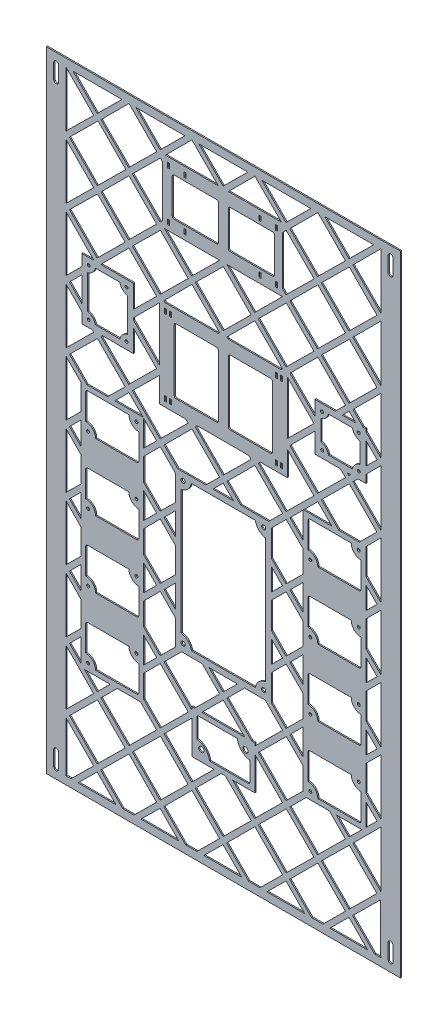
from build123d import *

# Parameters (mm, degrees)
SKETCH1_W           = 457.2
SKETCH1_H           = 812.8
BOARD_DEPTH         = 1.5875
SKETCH3_W           = 2.54
SKETCH3_H           = 6.35
ROBORIO_CHECK_DEPTH = 467.284720054
SKETCH4_W           = 2.54
SKETCH4_H           = 6.35
DLINK_CHECK_DEPTH   = 467.284720054
SKETCH5_R           = 1.905
VRM_DEPTH           = 467.284720054
SKETCH6_R           = 1.8415
SKETCH6_R_2         = 1.9304
PCM_DEPTH           = 467.284720054
SKETCH7_R           = 2.667
PDP_DEPTH           = 467.284720054
SKETCH8_R           = 3.429
MAIN_BREAKER_DEPTH  = 467.284720054
SKETCH9_R           = 1.905
CUT_EXTRUDE3_DEPTH  = 467.284720054
FILLET1_R           = 2.54
CUT_EXTRUDE4_DEPTH  = 467.284720054
CUT_EXTRUDE6_START  = -1.5875
CUT_EXTRUDE6_DEPTH  = 1.5875


# Read off the part's stored shape, not the designer's step: Cut-Extrude6
with BuildPart() as part:
    # Sketch1 → Board (new body)
    with BuildSketch(Plane.XY):
        Rectangle(SKETCH1_W, SKETCH1_H)
        with BuildLine():
            Line((-212.725, 393.7), (-212.725, 374.65))
            ThreePointArc((-212.725, 374.65), (-215.9, 371.475), (-219.075, 374.65))
            Line((-219.075, 374.65), (-219.075, 393.7))
            ThreePointArc((-219.075, 393.7), (-215.9, 396.875), (-212.725, 393.7))
        make_face(mode=Mode.SUBTRACT)
        with BuildLine():
            Line((-212.725, -374.65), (-212.725, -393.7))
            ThreePointArc((-212.725, -393.7), (-215.9, -396.875), (-219.075, -393.7))
            Line((-219.075, -393.7), (-219.075, -374.65))
            ThreePointArc((-219.075, -374.65), (-215.9, -371.475), (-212.725, -374.65))
        make_face(mode=Mode.SUBTRACT)
        with BuildLine():
            Line((219.075, 393.7), (219.075, 374.65))
            ThreePointArc((219.075, 374.65), (215.9, 371.475), (212.725, 374.65))
            Line((212.725, 374.65), (212.725, 393.7))
            ThreePointArc((212.725, 393.7), (215.9, 396.875), (219.075, 393.7))
        make_face(mode=Mode.SUBTRACT)
        with BuildLine():
            Line((219.075, -374.65), (219.075, -393.7))
            ThreePointArc((219.075, -393.7), (215.9, -396.875), (212.725, -393.7))
            Line((212.725, -393.7), (212.725, -374.65))
            ThreePointArc((212.725, -374.65), (215.9, -371.475), (219.075, -374.65))
        make_face(mode=Mode.SUBTRACT)
    extrude(amount=BOARD_DEPTH)

    # Sketch3 → RoboRio (check) (cut, through all)
    with BuildSketch(Plane.XY.offset(1.5875)):
        with Locations((-68.58, 187.325)):
            Rectangle(SKETCH3_W, SKETCH3_H)
        with Locations((-74.93, 187.325)):
            Rectangle(SKETCH3_W, SKETCH3_H)
        with Locations((74.93, 187.325)):
            Rectangle(SKETCH3_W, SKETCH3_H)
        with Locations((68.58, 187.325)):
            Rectangle(SKETCH3_W, SKETCH3_H)
        with Locations((-68.58, 89.535)):
            Rectangle(SKETCH3_W, SKETCH3_H)
        with Locations((-74.93, 89.535)):
            Rectangle(SKETCH3_W, SKETCH3_H)
        with Locations((74.93, 89.535)):
            Rectangle(SKETCH3_W, SKETCH3_H)
        with Locations((68.58, 89.535)):
            Rectangle(SKETCH3_W, SKETCH3_H)
        with BuildLine():
            Line((-6.35, 177.8), (-6.35, 99.06))
            ThreePointArc((-6.35, 99.06), (-7.093948776, 97.263948776), (-8.89, 96.52))
            Line((-8.89, 96.52), (-60.96, 96.52))
            ThreePointArc((-60.96, 96.52), (-62.756051224, 97.263948776), (-63.5, 99.06))
            Line((-63.5, 99.06), (-63.5, 177.8))
            ThreePointArc((-63.5, 177.8), (-62.756051224, 179.596051224), (-60.96, 180.34))
            Line((-60.96, 180.34), (-8.89, 180.34))
            ThreePointArc((-8.89, 180.34), (-7.093948776, 179.596051224), (-6.35, 177.8))
        make_face()
        with BuildLine():
            Line((63.5, 177.8), (63.5, 99.06))
            ThreePointArc((63.5, 99.06), (62.756051224, 97.263948776), (60.96, 96.52))
            Line((60.96, 96.52), (8.89, 96.52))
            ThreePointArc((8.89, 96.52), (7.093948776, 97.263948776), (6.35, 99.06))
            Line((6.35, 99.06), (6.35, 177.8))
            ThreePointArc((6.35, 177.8), (7.093948776, 179.596051224), (8.89, 180.34))
            Line((8.89, 180.34), (60.96, 180.34))
            ThreePointArc((60.96, 180.34), (62.756051224, 179.596051224), (63.5, 177.8))
        make_face()
    extrude(amount=-ROBORIO_CHECK_DEPTH, mode=Mode.SUBTRACT)

    # Sketch4 → DLink (check) (cut, through all)
    with BuildSketch(Plane.XY.offset(1.5875)):
        with Locations((-49.53, 352.425)):
            Rectangle(SKETCH4_W, SKETCH4_H)
        with Locations((-71.12, 352.425)):
            Rectangle(SKETCH4_W, SKETCH4_H)
        with Locations((68.58, 352.425)):
            Rectangle(SKETCH4_W, SKETCH4_H)
        with Locations((46.99, 352.425)):
            Rectangle(SKETCH4_W, SKETCH4_H)
        with Locations((-49.53, 288.925)):
            Rectangle(SKETCH4_W, SKETCH4_H)
        with Locations((-71.12, 288.925)):
            Rectangle(SKETCH4_W, SKETCH4_H)
        with Locations((68.58, 288.925)):
            Rectangle(SKETCH4_W, SKETCH4_H)
        with Locations((46.99, 288.925)):
            Rectangle(SKETCH4_W, SKETCH4_H)
        with BuildLine():
            Line((-6.35, 342.9), (-6.35, 298.45))
            ThreePointArc((-6.35, 298.45), (-7.093948776, 296.653948776), (-8.89, 295.91))
            Line((-8.89, 295.91), (-63.5, 295.91))
            ThreePointArc((-63.5, 295.91), (-65.296051224, 296.653948776), (-66.04, 298.45))
            Line((-66.04, 298.45), (-66.04, 342.9))
            ThreePointArc((-66.04, 342.9), (-65.296051224, 344.696051224), (-63.5, 345.44))
            Line((-63.5, 345.44), (-8.89, 345.44))
            ThreePointArc((-8.89, 345.44), (-7.093948776, 344.696051224), (-6.35, 342.9))
        make_face()
        with BuildLine():
            Line((66.04, 298.45), (66.04, 342.9))
            ThreePointArc((66.04, 342.9), (65.296051224, 344.696051224), (63.5, 345.44))
            Line((63.5, 345.44), (8.89, 345.44))
            ThreePointArc((8.89, 345.44), (7.093948776, 344.696051224), (6.35, 342.9))
            Line((6.35, 342.9), (6.35, 298.45))
            ThreePointArc((6.35, 298.45), (7.093948776, 296.653948776), (8.89, 295.91))
            Line((8.89, 295.91), (63.5, 295.91))
            ThreePointArc((63.5, 295.91), (65.296051224, 296.653948776), (66.04, 298.45))
        make_face()
    extrude(amount=-DLINK_CHECK_DEPTH, mode=Mode.SUBTRACT)

    # Sketch5 → VRM (cut, through all)
    with BuildSketch(Plane.XY.offset(1.5875)):
        with Locations((127.521245728, 133.238447305)):
            Circle(SKETCH5_R)
        with Locations((127.306297173, 176.163909132)):
            Circle(SKETCH5_R)
        with Locations((174.727219389, 176.401368632)):
            Circle(SKETCH5_R)
        with Locations((174.942167944, 133.475906804)):
            Circle(SKETCH5_R)
        with BuildLine():
            Line((135.642459208, 177.8), (166.596834475, 177.8))
            ThreePointArc((166.596834475, 177.8), (170.057072731, 171.358178028), (176.495761684, 167.892113449))
            Line((176.495761684, 167.892113449), (176.495761684, 141.729407893))
            ThreePointArc((176.495761684, 141.729407893), (170.055505563, 138.266256121), (166.592353791, 131.826))
            Line((166.592353791, 131.826), (135.720216995, 131.826))
            ThreePointArc((135.720216995, 131.826), (132.301895968, 138.429867689), (125.772244935, 141.987907103))
            Line((125.772244935, 141.987907103), (125.772244935, 168.078884744))
            ThreePointArc((125.772244935, 168.078884744), (132.149564522, 171.475109778), (135.642459208, 177.8))
        make_face()
    extrude(amount=-VRM_DEPTH, mode=Mode.SUBTRACT)

    # Sketch6 → PCM (cut, through all)
    with BuildSketch(Plane.XY.offset(1.5875)):
        with Locations((-173.9392, 189.1792)):
            Circle(SKETCH6_R)
        with Locations((-125.1204, 189.1792)):
            Circle(SKETCH6_R)
        with Locations((-173.9392, 128.397)):
            Circle(SKETCH6_R)
        with Locations((-125.1204, 128.397)):
            Circle(SKETCH6_R_2)
        with BuildLine():
            Line((-165.356592107, 190.5), (-133.703007893, 190.5))
            ThreePointArc((-133.703007893, 190.5), (-130.239856121, 184.059743879), (-123.7996, 180.596592107))
            Line((-123.7996, 180.596592107), (-123.7996, 136.979607893))
            ThreePointArc((-123.7996, 136.979607893), (-130.239856121, 133.516456121), (-133.703007893, 127.0762))
            Line((-133.703007893, 127.0762), (-165.356592107, 127.0762))
            ThreePointArc((-165.356592107, 127.0762), (-168.819743879, 133.516456121), (-175.26, 136.979607893))
            Line((-175.26, 136.979607893), (-175.26, 180.596592107))
            ThreePointArc((-175.26, 180.596592107), (-168.819743879, 184.059743879), (-165.356592107, 190.5))
        make_face()
    extrude(amount=-PCM_DEPTH, mode=Mode.SUBTRACT)

    # Sketch7 → PDP (cut, through all)
    with BuildSketch(Plane.XY.offset(1.5875)):
        with Locations((-52.0192, 9.2202)):
            Circle(SKETCH7_R)
        with Locations((52.0192, 9.2202)):
            Circle(SKETCH7_R)
        with Locations((51.9938, -172.7708)):
            Circle(SKETCH7_R)
        with Locations((-51.9938, -172.7708)):
            Circle(SKETCH7_R)
        with BuildLine():
            Line((-54.483, -1.446482603), (-54.483, -162.129517397))
            ThreePointArc((-54.483, -162.129517397), (-45.797679849, -166.574679849), (-41.352517397, -175.26))
            Line((-41.352517397, -175.26), (41.352517397, -175.26))
            ThreePointArc((41.352517397, -175.26), (45.797679849, -166.574679849), (54.483, -162.129517397))
            Line((54.483, -162.129517397), (54.483, -1.446482603))
            ThreePointArc((54.483, -1.446482603), (45.797679849, 2.998679849), (41.352517397, 11.684))
            Line((41.352517397, 11.684), (-41.352517397, 11.684))
            ThreePointArc((-41.352517397, 11.684), (-45.797679849, 2.998679849), (-54.483, -1.446482603))
        make_face()
    extrude(amount=-PDP_DEPTH, mode=Mode.SUBTRACT)

    # Sketch8 → Main Breaker (cut, through all)
    with BuildSketch(Plane.XY.offset(1.5875)):
        with Locations((-28.448, -279.4)):
            Circle(SKETCH8_R)
        with Locations((28.448, -251.46)):
            Circle(SKETCH8_R)
        with BuildLine():
            Line((-17.950092691, -287.02), (34.29, -287.02))
            Line((34.29, -287.02), (34.29, -260.179907309))
            ThreePointArc((34.29, -260.179907309), (23.359615818, -254.770384182), (17.950092691, -243.84))
            Line((17.950092691, -243.84), (-34.29, -243.84))
            Line((-34.29, -243.84), (-34.29, -270.680092691))
            ThreePointArc((-34.29, -270.680092691), (-23.359615818, -276.089615818), (-17.950092691, -287.02))
        make_face()
    extrude(amount=-MAIN_BREAKER_DEPTH, mode=Mode.SUBTRACT)

    # Sketch9 → Cut-Extrude3 (cut, through all)
    with BuildSketch(Plane.XY.offset(1.5875)):
        with Locations((-174.752, 3.048)):
            Circle(SKETCH9_R)
        with Locations((-112.268, 45.212)):
            Circle(SKETCH9_R)
        with Locations((-174.752, -83.312)):
            Circle(SKETCH9_R)
        with Locations((-112.268, -41.148)):
            Circle(SKETCH9_R)
        with Locations((-174.752, -169.672)):
            Circle(SKETCH9_R)
        with Locations((-112.268, -127.508)):
            Circle(SKETCH9_R)
        with Locations((-174.752, -256.032)):
            Circle(SKETCH9_R)
        with Locations((-112.268, -213.868)):
            Circle(SKETCH9_R)
        with Locations((112.268, 3.048)):
            Circle(SKETCH9_R)
        with Locations((174.752, 45.212)):
            Circle(SKETCH9_R)
        with Locations((112.268, -83.312)):
            Circle(SKETCH9_R)
        with Locations((174.752, -41.148)):
            Circle(SKETCH9_R)
        with Locations((112.268, -169.672)):
            Circle(SKETCH9_R)
        with Locations((174.752, -127.508)):
            Circle(SKETCH9_R)
        with Locations((112.268, -256.032)):
            Circle(SKETCH9_R)
        with Locations((174.752, -213.868)):
            Circle(SKETCH9_R)
        with BuildLine():
            Line((-177.8, -38.1), (-121.92, -38.1))
            ThreePointArc((-121.92, -38.1), (-118.200256121, -47.080256121), (-109.22, -50.8))
            Line((-109.22, -50.8), (-109.22, -86.36))
            Line((-109.22, -86.36), (-165.1, -86.36))
            ThreePointArc((-165.1, -86.36), (-168.819743879, -77.379743879), (-177.8, -73.66))
            Line((-177.8, -73.66), (-177.8, -38.1))
        make_face()
        with BuildLine():
            Line((-177.8, 48.26), (-121.92, 48.26))
            ThreePointArc((-121.92, 48.26), (-118.200256121, 39.279743879), (-109.22, 35.56))
            Line((-109.22, 35.56), (-109.22, 0))
            Line((-109.22, 0), (-165.1, 0))
            ThreePointArc((-165.1, 0), (-168.819743879, 8.980256121), (-177.8, 12.7))
            Line((-177.8, 12.7), (-177.8, 48.26))
        make_face()
        with BuildLine():
            Line((-177.8, -124.46), (-121.92, -124.46))
            ThreePointArc((-121.92, -124.46), (-118.200256121, -133.440256121), (-109.22, -137.16))
            Line((-109.22, -137.16), (-109.22, -172.72))
            Line((-109.22, -172.72), (-165.1, -172.72))
            ThreePointArc((-165.1, -172.72), (-168.819743879, -163.739743879), (-177.8, -160.02))
            Line((-177.8, -160.02), (-177.8, -124.46))
        make_face()
        with BuildLine():
            Line((-177.8, -210.82), (-121.92, -210.82))
            ThreePointArc((-121.92, -210.82), (-118.200256121, -219.800256121), (-109.22, -223.52))
            Line((-109.22, -223.52), (-109.22, -259.08))
            Line((-109.22, -259.08), (-165.1, -259.08))
            ThreePointArc((-165.1, -259.08), (-168.819743879, -250.099743879), (-177.8, -246.38))
            Line((-177.8, -246.38), (-177.8, -210.82))
        make_face()
        with BuildLine():
            Line((109.22, 48.26), (165.1, 48.26))
            ThreePointArc((165.1, 48.26), (168.819743879, 39.279743879), (177.8, 35.56))
            Line((177.8, 35.56), (177.8, 0))
            Line((177.8, 0), (121.92, 0))
            ThreePointArc((121.92, 0), (118.200256121, 8.980256121), (109.22, 12.7))
            Line((109.22, 12.7), (109.22, 48.26))
        make_face()
        with BuildLine():
            Line((109.22, -38.1), (165.1, -38.1))
            ThreePointArc((165.1, -38.1), (168.819743879, -47.080256121), (177.8, -50.8))
            Line((177.8, -50.8), (177.8, -86.36))
            Line((177.8, -86.36), (121.92, -86.36))
            ThreePointArc((121.92, -86.36), (118.200256121, -77.379743879), (109.22, -73.66))
            Line((109.22, -73.66), (109.22, -38.1))
        make_face()
        with BuildLine():
            Line((109.22, -124.46), (165.1, -124.46))
            ThreePointArc((165.1, -124.46), (168.819743879, -133.440256121), (177.8, -137.16))
            Line((177.8, -137.16), (177.8, -172.72))
            Line((177.8, -172.72), (121.92, -172.72))
            ThreePointArc((121.92, -172.72), (118.200256121, -163.739743879), (109.22, -160.02))
            Line((109.22, -160.02), (109.22, -124.46))
        make_face()
        with BuildLine():
            Line((109.22, -210.82), (165.1, -210.82))
            ThreePointArc((165.1, -210.82), (168.819743879, -219.800256121), (177.8, -223.52))
            Line((177.8, -223.52), (177.8, -259.08))
            Line((177.8, -259.08), (121.92, -259.08))
            ThreePointArc((121.92, -259.08), (118.200256121, -250.099743879), (109.22, -246.38))
            Line((109.22, -246.38), (109.22, -210.82))
        make_face()
    extrude(amount=-CUT_EXTRUDE3_DEPTH, mode=Mode.SUBTRACT)

    # Fillet1
    fillet1_edges = [part.edges().sort_by_distance(p)[0] for p in [
        (-34.29, -243.84, 0.79375),
        (34.29, -287.02, 0.79375),
        (-177.8, 48.26, 0.79375),
        (-109.22, 0, 0.79375),
        (-177.8, -38.1, 0.79375),
        (-109.22, -86.36, 0.79375),
        (-177.8, -124.46, 0.79375),
        (-109.22, -172.72, 0.79375),
        (-177.8, -210.82, 0.79375),
        (-109.22, -259.08, 0.79375),
        (109.22, 48.26, 0.79375),
        (177.8, 0, 0.79375),
        (109.22, -38.1, 0.79375),
        (177.8, -86.36, 0.79375),
        (109.22, -124.46, 0.79375),
        (177.8, -172.72, 0.79375),
        (109.22, -210.82, 0.79375),
        (177.8, -259.08, 0.79375),
    ]]
    fillet(fillet1_edges, radius=FILLET1_R)

    # Sketch10 → Cut-Extrude4 (cut, through all)
    with BuildSketch(Plane.XY.offset(1.5875)):
        Polygon((-184.15, -18.105497537), (-198.709767506, -3.38129333), (-184.15, 11.178474552), align=None)
        Polygon((-184.15, 20.346070137), (-184.15, 53.685684495), (-203.2, 72.950833477), (-203.2, 1.508816382), align=None)
        Polygon((-184.15, -60.476221494), (-184.15, -27.136607135), (-203.2, -7.871458154), (-203.2, -79.313475249), align=None)
        Polygon((-184.15, -98.927789167), (-198.709760777, -84.203591766), (-184.15, -69.643830538), align=None)
        Polygon((-184.15, -107.958898766), (-203.2, -88.693749785), (-203.2, -160.13576688), (-184.15, -141.298513125), align=None)
        Polygon((-184.15, -179.750080798), (-198.709754048, -165.025890202), (-184.15, -150.466135627), align=None)
        Polygon((-184.15, -188.781190397), (-203.2, -169.516041416), (-203.2, -240.958058511), (-184.15, -222.120804755), align=None)
        Polygon((-86.201257629, -205.638201805), (-102.87, -222.120791297), (-102.87, -188.781204162), align=None)
        Polygon((-81.685987581, -201.173357307), (-102.87, -179.750094563), (-102.87, -150.466135627), (-81.508847455, -129.104983083), (-62.103, -148.510830538), (-62.103, -181.80906826), align=None)
        Polygon((-81.685987581, -120.351065676), (-102.87, -98.927802932), (-102.87, -69.643830538), (-81.508847455, -48.282677993), (-62.103, -67.688525448), (-62.103, -100.986776629), align=None)
        Polygon((-86.201257629, -124.815910174), (-102.87, -141.298499666), (-102.87, -107.958912531), align=None)
        Polygon((-62.103, -110.156830538), (-62.103, -139.072879506), (-76.561024484, -124.614855022), align=None)
        Polygon((-86.201257629, -43.993618543), (-102.87, -60.476208035), (-102.87, -27.1366209), align=None)
        Polygon((-81.685987581, -39.528774045), (-102.87, -18.105511301), (-102.87, 11.178474552), (-81.508847455, 32.539627097), (-62.103, 13.133779642), (-62.103, -20.164484998), align=None)
        Polygon((-62.103, -29.334525448), (-62.103, -58.250574417), (-76.561024484, -43.792549932), align=None)
        Polygon((-86.201257629, 36.828673088), (-102.87, 20.346083596), (-102.87, 53.685670731), align=None)
        Polygon((-103.784006561, 54.61), (-121.919996435, 72.950816107), (-140.260779642, 54.61), align=None)
        Polygon((-81.685987581, 41.293517586), (-117.430347453, 77.441571033), (-82.55, 111.932373729), (-82.55, 80.01), (-48.528113872, 80.01), (-45.563846883, 77.012254096), align=None)
        Polygon((-176.133740814, 54.61), (-198.710131766, 77.441366675), (-162.587971377, 113.160122656), (-126.843813581, 77.012273567), (-149.499096405, 54.61), align=None)
        Polygon((-156.236884731, 119.4562), (-116.1796, 119.4562), (-116.1796, 147.967879783), (-86.201257629, 117.650964719), (-122.323418018, 81.932208737), (-158.042147006, 117.650937725), align=None)
        Polygon((-167.481244019, 117.650964719), (-203.2, 82.331108012), (-203.200542957, 153.773674196), (-182.88, 133.223632861), (-182.88, 119.4562), (-169.266318826, 119.4562), align=None)
        Polygon((-182.88, 142.25474246), (-198.709780964, 158.263303542), (-182.88, 174.093084731), align=None)
        Polygon((-167.481244019, 198.47325635), (-167.838490014, 198.12), (-182.88, 198.12), (-182.88, 183.246470316), (-203.2, 163.153399643), (-203.2, 234.595416738), align=None)
        Polygon((-82.55, 122.989579714), (-116.1796, 156.998989382), (-116.1796, 159.513484731), (-82.55, 193.143084731), align=None)
        Polygon((-4.92127124, 36.828673088), (-40.640027221, 72.950833477), (-76.561065013, 37.029795686), (-58.835269327, 19.304), (-22.643866405, 19.304), align=None)
        Polygon((-0.406001192, 41.293517586), (-36.150354335, 77.441564228), (-33.55291023, 80.01), (32.751882819, 80.01), (35.716144715, 77.012259247), align=None)
        Polygon((-13.464474552, 19.304), (13.006779642, 19.304), (-0.228847455, 32.539627097), align=None)
        Polygon((22.444730673, 19.304), (4.718928182, 37.029802491), (40.639959168, 72.950833477), (76.358715149, 36.828673088), (58.636119984, 19.304), align=None)
        Polygon((80.873985198, 41.293517586), (45.129638783, 77.441557423), (47.72708977, 80.01), (82.55, 80.01), (82.55, 111.847440998), (116.996136313, 77.012264397), align=None)
        Polygon((80.873985198, -39.528774045), (62.103, -20.545791034), (62.103, 13.591474552), (81.051152545, 32.539627097), (102.87, 10.720779642), (102.87, -17.778405938), align=None)
        Polygon((102.87, 53.90077334), (102.87, 20.158730673), (85.99898146, 37.029749213), align=None)
        Polygon((140.055952606, 54.61), (121.919999389, 72.950779037), (103.579226426, 54.61), align=None)
        Polygon((118.152244935, 150.005329666), (118.152244935, 124.206), (151.156871461, 124.206), (157.638701538, 117.650964719), (121.516541149, 81.932208737), (85.797832578, 117.650917309), align=None)
        Polygon((148.986204743, 54.61), (126.409840707, 77.441339455), (162.532001095, 113.160095436), (198.276131976, 77.012273567), (175.620849152, 54.61), align=None)
        Polygon((203.2, 153.773084731), (184.115761684, 134.688846415), (184.115761684, 124.206), (173.632915269, 124.206), (167.278975516, 117.852060247), (203.2, 81.931035763), align=None)
        Polygon((203.2, 72.950779642), (203.2, 1.108730673), (184.15, 20.158730673), (184.15, 53.900779642), align=None)
        Polygon((198.479601371, -3.60882097), (184.15, -17.778392479), (184.15, 10.720779642), align=None)
        Polygon((203.2, -7.871525448), (203.2, -79.713574417), (184.15, -60.663574417), (184.15, -26.921525448), align=None)
        Polygon((102.87, -26.921525448), (102.87, -60.663574417), (85.998975516, -43.792549932), align=None)
        Polygon((76.358715149, -43.993618543), (62.103, -58.090128975), (62.103, -29.576900633), align=None)
        Polygon((80.873985198, -120.351065676), (62.103, -101.368082665), (62.103, -67.230830538), (81.051152545, -48.282677993), (102.87, -70.101525448), (102.87, -98.600697569), align=None)
        Polygon((198.479594642, -84.431119255), (184.15, -98.60068411), (184.15, -70.101525448), align=None)
        Polygon((116.996141406, 157.834561064), (82.55, 123.773106651), (82.55, 192.669742816), align=None)
        Polygon((157.638701538, 198.47325635), (121.919945557, 234.595416738), (85.998934835, 198.674406017), (118.152244935, 166.521095918), (118.152244935, 185.42), (144.438022889, 185.42), align=None)
        Polygon((162.331152545, 194.184237276), (153.566915269, 185.42), (171.095389821, 185.42), align=None)
        Polygon((198.479614524, 158.035775297), (184.115761684, 172.399628137), (184.115761684, 143.832334833), align=None)
        Polygon((180.533340852, 185.42), (167.278975516, 198.674365336), (203.2, 234.595389821), (203.2, 162.753340852), (184.115761684, 181.837579168), (184.115761684, 185.42), align=None)
        Polygon((162.153971587, 202.938100847), (126.409618444, 239.08614749), (162.531778832, 274.804903471), (198.276131976, 238.656856829), align=None)
        Polygon((80.873985198, 202.938100847), (45.129625325, 239.086154295), (81.251785714, 274.804910276), (116.996145586, 238.656856829), align=None)
        Polygon((76.358715149, 198.47325635), (40.639959168, 234.595416738), (4.517799568, 198.473257139), (6.141056707, 196.85), (74.717125889, 196.85), align=None)
        Polygon((-0.406001192, 202.938100847), (-36.150367793, 239.0861611), (-0.028207404, 274.804917081), (35.716159197, 238.656856829), align=None)
        Polygon((-4.92127124, 198.47325635), (-40.640027221, 234.595416738), (-76.762191972, 198.473251988), (-75.138939984, 196.85), (-6.562860501, 196.85), align=None)
        Polygon((-81.685987581, 202.938100847), (-117.430360911, 239.086167905), (-81.308200522, 274.804923886), (-45.563827192, 238.656856829), align=None)
        Polygon((-86.201257629, 198.47325635), (-121.920013611, 234.595416738), (-157.841044748, 198.674385601), (-157.286659148, 198.12), (-116.1796, 198.12), (-116.1796, 168.829705567), align=None)
        Polygon((-162.96597397, 202.938100847), (-198.710354029, 239.08617471), (-162.58819364, 274.804930691), (-126.843813581, 238.656856829), align=None)
        Polygon((-167.481244019, 279.29554798), (-203.2, 243.975691274), (-203.2, 315.417708369), align=None)
        Polygon((-86.201257629, 279.29554798), (-121.920013611, 315.417708369), (-158.042173999, 279.29554798), (-122.323418018, 243.576791999), align=None)
        Polygon((-162.96597397, 283.760392478), (-198.909726962, 320.110090973), (-161.872264789, 356.733926848), (-125.928511797, 320.384228353), align=None)
        Polygon((-167.481244019, 360.117839611), (-203.2, 324.797982905), (-203.2, 396.24), align=None)
        Polygon((-162.96597397, 364.582684109), (-194.269747863, 396.24), (-130.95112321, 396.24), align=None)
        Polygon((-86.201257629, 360.117839611), (-121.920013611, 396.24), (-158.042173999, 360.117839611), (-122.323418018, 324.39908363), align=None)
        Polygon((-81.685987581, 283.760392478), (-117.43036764, 319.908466341), (-81.307706073, 355.627706073), (-78.74, 353.06), (-78.74, 286.673479912), align=None)
        Polygon((-112.989761474, 396.24), (-49.67113682, 396.24), (-81.685987581, 364.582684109), align=None)
        Polygon((-6.732970461, 361.95), (-40.640013764, 396.23998639), (-74.93, 361.95), align=None)
        Polygon((-40.840591448, 243.777366905), (-76.065391378, 279.4), (-4.815639549, 279.4), align=None)
        Polygon((-31.709775085, 396.24), (31.608849569, 396.24), (-0.406001192, 364.582684109), align=None)
        Polygon((40.64, 396.24), (6.35, 361.95), (74.93, 361.95), align=None)
        Polygon((49.570211305, 396.24), (112.888835958, 396.24), (80.873985198, 364.582684109), align=None)
        Polygon((40.23655476, 243.576791999), (4.815645942, 279.4), (76.2, 279.4), (76.2, 279.456055644), (76.358715149, 279.29554798), align=None)
        Polygon((80.873985198, 283.760392478), (76.2, 288.487165243), (76.2, 350.97769491), (81.05115681, 355.82885172), (117.199635016, 319.680365364), align=None)
        Polygon((157.638701538, 279.29554798), (121.919945557, 315.417708369), (85.797785168, 279.29554798), (121.516541149, 243.576791999), align=None)
        Polygon((162.153971587, 283.760392478), (126.409611715, 319.908445926), (162.531772103, 355.627201907), (198.276131976, 319.479148459), align=None)
        Polygon((130.850197694, 396.24), (194.168822347, 396.24), (162.153971587, 364.582684109), align=None)
        Polygon((203.2, 396.24), (203.2, 324.397951031), (167.278975516, 360.318975516), align=None)
        Polygon((203.2, 315.41769491), (203.2, 243.575645942), (167.278975516, 279.496670426), align=None)
        Polygon((157.638701538, 360.117839611), (121.919945557, 396.24), (85.797785168, 360.117839611), (121.51654115, 324.39908363), align=None)
        Polygon((76.358715149, -124.815910174), (62.103, -138.912420606), (62.103, -110.399192264), align=None)
        Polygon((102.87, -107.743830538), (102.87, -141.485879506), (85.998975516, -124.614855022), align=None)
        Polygon((81.051152545, -129.104983083), (62.103, -148.053135627), (62.103, -182.190374296), (80.873985198, -201.173357307), (102.87, -179.4229892), (102.87, -150.923830538), align=None)
        Polygon((203.2, -88.693830538), (203.2, -160.535879506), (184.15, -141.485879506), (184.15, -107.743830538), align=None)
        Polygon((160.087123598, 124.206), (164.267768797, 124.206), (162.153971587, 122.115809216), align=None)
    extrude(amount=-CUT_EXTRUDE4_DEPTH, mode=Mode.SUBTRACT)

    # Cut-Extrude6 outline → Cut-Extrude6 (cut)
    with BuildSketch(Plane.XY.offset(1.5875).offset(CUT_EXTRUDE6_START)):
        Polygon((-184.15, -260.572372429), (-184.15, -231.288440717), (-198.709747319, -245.848188637), align=None)
        Polygon((-167.481244019, -286.460493435), (-203.2, -250.338333047), (-203.2, -321.780350142), align=None)
        Polygon((-167.481244019, -367.282785066), (-203.2, -331.160624678), (-203.2, -396.24), (-196.765499125, -396.24), align=None)
        Polygon((-81.508837969, -209.927278686), (-102.87, -231.288440717), (-102.87, -260.572386194), (-81.685987581, -281.995648938), (-45.360398629, -246.075736239), align=None)
        Polygon((102.87, -260.24528083), (102.87, -231.746135627), (81.252293927, -210.128429554), (45.129665699, -245.84763632), (80.873985198, -281.995648938), align=None)
        Polygon((102.87, -222.308184596), (102.87, -188.566135627), (85.998975516, -205.437160112), align=None)
        Polygon((203.2, -241.358184596), (203.2, -169.516135627), (184.15, -188.566135627), (184.15, -222.308184596), align=None)
        Polygon((203.2, -322.180489686), (203.2, -250.338440717), (167.278975516, -286.259465201), align=None)
        Polygon((198.479587913, -165.253417539), (184.15, -150.923830538), (184.15, -179.422975741), align=None)
        Polygon((198.479581184, -246.075715824), (184.15, -231.746135627), (184.15, -260.245267372), align=None)
        Polygon((53.854671978, -182.88), (27.276135627, -182.88), (4.718975516, -205.437160112), (36.771815404, -237.49), (40.64, -237.49), (40.64, -240.958018135), (76.358715149, -205.638201805), align=None)
        Polygon((-162.96597397, -281.995648938), (-146.213234088, -265.43), (-179.346621354, -265.43), align=None)
        Polygon((-198.710306926, -326.669914341), (-162.96597397, -362.817940569), (-126.843813581, -327.099184587), (-162.588146538, -290.95115836), align=None)
        Polygon((-158.501129472, -367.333210617), (-129.917164808, -396.24), (-115.485512736, -396.24), (-86.201257629, -367.282785066), (-121.920013611, -331.160624678), align=None)
        Polygon((-163.016399521, -371.798055115), (-187.734389526, -396.24), (-138.847416945, -396.24), align=None)
        Polygon((-77.017951026, -367.538697507), (-48.637178418, -396.24), (-34.205526347, -396.24), (-4.92127124, -367.282785066), (-40.640027221, -331.160624678), align=None)
        Polygon((-81.736413132, -371.798055115), (-106.454403137, -396.24), (-57.567430555, -396.24), align=None)
        Polygon((-0.456426743, -371.798055115), (-25.174416748, -396.24), (23.712555834, -396.24), align=None)
        Polygon((4.262042092, -367.538704312), (32.642807971, -396.24), (47.074460042, -396.24), (76.358715149, -367.282785066), (40.639959168, -331.160624678), align=None)
        Polygon((80.823559647, -371.798055115), (56.105569641, -396.24), (104.992542223, -396.24), align=None)
        Polygon((85.542035211, -367.538711117), (113.92279436, -396.24), (128.354446432, -396.24), (157.638701538, -367.282785066), (121.919945557, -331.160624678), align=None)
        Polygon((162.103546036, -371.798055115), (137.38555603, -396.24), (186.272528612, -396.24), align=None)
        Polygon((166.819019406, -367.535675017), (195.202780749, -396.24), (203.2, -396.24), (202.941179795, -331.816919036), align=None)
        Polygon((-81.685987581, -362.817940569), (-45.563827192, -327.099184587), (-81.308153419, -290.951165165), (-117.430313808, -326.669921146), align=None)
        Polygon((-106.996887102, -265.43), (-137.011559283, -265.43), (-158.042113359, -286.460554076), (-122.323418018, -322.179249417), (-86.201257629, -286.460493435), align=None)
        Polygon((136.843072066, -265.43), (106.828440717, -265.43), (85.797866225, -286.460574492), (121.516541149, -322.179249417), (157.638701538, -286.460493435), align=None)
        Polygon((178.906711469, -265.43), (145.773324203, -265.43), (162.153971587, -281.995648938), align=None)
        Polygon((-40.64, -293.37), (-40.64, -250.338351707), (-76.559260511, -285.856469768), (-40.840527351, -321.978611129), (-11.908813148, -293.37), align=None)
        Polygon((-40.64, -241.358184596), (-40.64, -237.49), (-37.132800771, -237.49), (-4.92127124, -205.638201805), (-27.425314412, -182.88), (-54.003864373, -182.88), (-76.561024484, -205.437160112), align=None)
        Polygon((40.64, -293.37), (11.829510314, -293.37), (40.23655476, -322.179249417), (76.358715149, -286.460493435), (40.639959168, -250.338333047), align=None)
        Polygon((2.391559283, -293.37), (-2.849254193, -293.37), (-36.149754354, -326.670500683), (-0.406001192, -362.817940569), (35.919587913, -326.898027719), align=None)
        Polygon((80.873985198, -362.817940569), (116.996145586, -327.099184587), (81.251832817, -290.951178774), (45.129672428, -326.669934756), align=None)
        Polygon((162.153971587, -362.817940569), (198.276131976, -327.099184587), (162.531825935, -290.951185579), (126.409665546, -326.669941561), align=None)
        Polygon((18.093959642, -182.88), (-18.495062275, -182.88), (-0.406001192, -201.173357307), align=None)
        Polygon((-0.228847455, -209.927288172), (-27.791559283, -237.49), (27.333864373, -237.49), align=None)
    extrude(amount=CUT_EXTRUDE6_DEPTH, mode=Mode.SUBTRACT)


solid = part.part
